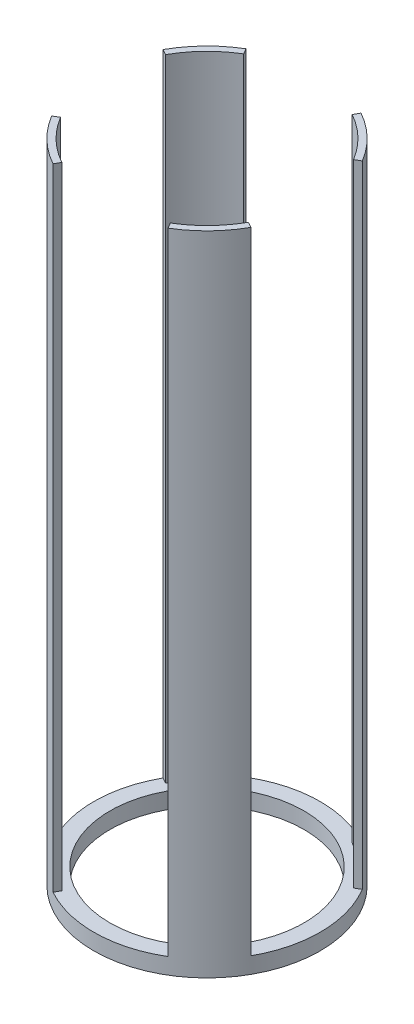
from build123d import *

# Parameters (mm, degrees)
SKETCH2_R               = 88.9
SKETCH2_R_2             = 83.82
BOSS_EXTRUDE1_DEPTH     = 254
CUT_EXTRUDE1_DEPTH      = 284.412102776
CUT_EXTRUDE1_DEPTH_BACK = 284.412102776
SKETCH4_R               = 88.9
SKETCH4_R_2             = 76.2
BOSS_EXTRUDE2_DEPTH     = 12.7


with BuildPart() as part:
    # Sketch2 → Boss-Extrude1 (new, symmetric)
    with BuildSketch(Plane(origin=(0, 0, 0), x_dir=(1, 0, 0), z_dir=(0, 1, 0))):
        Circle(SKETCH2_R)
        Circle(SKETCH2_R_2, mode=Mode.SUBTRACT)
    extrude(amount=BOSS_EXTRUDE1_DEPTH, both=True)

    # Sketch3 → Cut-Extrude1 (cut, two sides: drawn at the far end of the back side and taken through both)
    with BuildSketch(Plane(origin=(0, 0, 0), x_dir=(1, 0, 0), z_dir=(0, 1, 0)).offset(-CUT_EXTRUDE1_DEPTH_BACK)):
        Polygon((-58.116685864, 96.974944394), (0, 0), (53.900027233, 96.974944394), align=None)
        Polygon((70.991745134, -118.45858783), (0, 0), (-65.840936026, -118.45858783), align=None)
        Polygon((169.661755759, 101.677593364), (0, 0), (169.661755759, -94.300371224), align=None)
        Polygon((-123.741299607, -74.157652604), (0, 0), (-123.741299607, 68.777140945), align=None)
    extrude(amount=CUT_EXTRUDE1_DEPTH + CUT_EXTRUDE1_DEPTH_BACK, mode=Mode.SUBTRACT)


with BuildPart() as cut_extrude1_piece_1:
    # of the separate pieces the step leaves, piece 1, a body of its own (cut_extrude1_pieces)
    add(part.part.solids().sort_by_distance((-45.699187432, -254, -76.254798328))[0])



with BuildPart() as cut_extrude1_piece_2:
    # of the separate pieces the step leaves, piece 2, a body of its own (cut_extrude1_pieces)
    add(part.part.solids().sort_by_distance((45.699187432, -254, 76.254798328))[0])


with BuildPart() as cut_extrude1_piece_3:
    # of the separate pieces the step leaves, piece 3, a body of its own (cut_extrude1_pieces)
    add(part.part.solids().sort_by_distance((76.254798328, -254, -45.699187432))[0])


with BuildPart() as cut_extrude1_piece_4:
    # of the separate pieces the step leaves, piece 4, a body of its own (cut_extrude1_pieces)
    add(part.part.solids().sort_by_distance((-76.254798328, -254, 45.699187432))[0])


with BuildPart() as cut_extrude1_piece_1_1:
    add(cut_extrude1_piece_1.part)

    add(cut_extrude1_piece_2.part)  # Boss-Extrude2 merges Cut-Extrude1 piece 2

    add(cut_extrude1_piece_3.part)  # Boss-Extrude2 merges Cut-Extrude1 piece 3

    add(cut_extrude1_piece_4.part)  # Boss-Extrude2 merges Cut-Extrude1 piece 4
    # Sketch4 → Boss-Extrude2 (add)
    with BuildSketch(Plane.XZ.offset(254)):
        Circle(SKETCH4_R)
        Circle(SKETCH4_R_2, mode=Mode.SUBTRACT)
    extrude(amount=-BOSS_EXTRUDE2_DEPTH)


solid = cut_extrude1_piece_1_1.part
